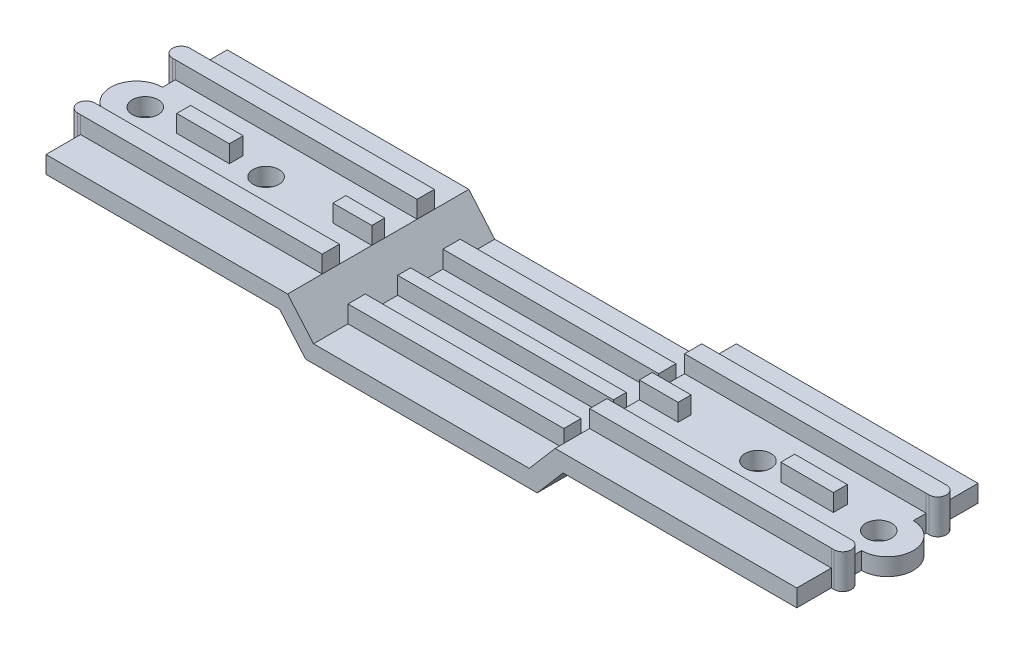
from build123d import *

# Parameters (mm, degrees)
SALIENTE_EXTRUIR1_DEPTH = 10.5
CORTAR_EXTRUIR1_DEPTH   = 48.9869774
ENVOLVER1_OUTLINE_W     = 4.5
ENVOLVER1_OUTLINE_H     = 1.5
ENVOLVER1_OUTLINE_W_2   = 6.094706288
ENVOLVER1_OUTLINE_H_2   = 1.606152826
ENVOLVER1_DEPTH         = 2
ENVOLVER1_START         = -3.5
ENVOLVER1_2_OUTLINE_W   = 25
ENVOLVER1_2_OUTLINE_H   = 2
ENVOLVER1_2_OUTLINE_H_2 = 1.5
ENVOLVER1_2_DEPTH       = 2
CROQUIS5_R              = 1.5
CORTAR_EXTRUIR2_DEPTH   = 48.9869774


# Read off the part's stored shape, not the designer's step: Envolver1
with BuildPart() as part:
    # Croquis1 → Saliente-Extruir1 (new, symmetric)
    with BuildSketch(Plane.XY):
        Polygon((-46.5, 2), (-46.5, 0), (-16.419869845, 0), (-13.785714286, 0), (-15.5, 2), align=None)
        Polygon((-13.785714286, 0), (-16.419869845, 0), (-13.419869845, -3.5), (13.419869845, -3.5), (16.419869845, 0), (13.785714286, 0), (12.5, -1.5), (-12.5, -1.5), align=None)
        Polygon((15.5, 2), (13.785714286, 0), (16.419869845, 0), (46.5, 0), (46.5, 2), align=None)
    extrude(amount=SALIENTE_EXTRUIR1_DEPTH, both=True)

    # Croquis3 → Cortar-Extruir1 (cut, through all)
    with BuildSketch(Plane(origin=(0, 2, 0), x_dir=(1, 0, 0), z_dir=(0, 1, 0))):
        with BuildLine():
            Line((-43.833986837, -4.5), (-43.5, -4.5))
            Line((-43.5, -4.5), (-43.5, -3))
            ThreePointArc((-43.5, -3), (-46.5, 0), (-43.5, 3))
            Line((-43.5, 3), (-43.5, 4.5))
            Line((-43.5, 4.5), (-43.833986837, 4.5))
            ThreePointArc((-43.833986837, 4.5), (-44.833986837, 5.5), (-43.833986837, 6.5))
            Line((-43.833986837, 6.5), (-43.5, 6.5))
            Line((-43.5, 6.5), (-43.5, 10.5))
            Line((-43.5, 10.5), (-43.5, 12.222660865))
            Line((-43.5, 12.222660865), (-52.324213339, 12.222660865))
            Line((-52.324213339, 12.222660865), (-52.324213339, -12.147175549))
            Line((-52.324213339, -12.147175549), (-43.5, -12.147175549))
            Line((-43.5, -12.147175549), (-43.5, -10.5))
            Line((-43.5, -10.5), (-43.5, -6.5))
            Line((-43.5, -6.5), (-43.833986837, -6.5))
            ThreePointArc((-43.833986837, -6.5), (-44.833986837, -5.5), (-43.833986837, -4.5))
        make_face()
        with BuildLine():
            Line((43.5, 12.222660865), (43.5, 10.5))
            Line((43.5, 10.5), (43.5, 6.5))
            Line((43.5, 6.5), (43.833986837, 6.5))
            ThreePointArc((43.833986837, 6.5), (44.833986837, 5.5), (43.833986837, 4.5))
            Line((43.833986837, 4.5), (43.5, 4.5))
            Line((43.5, 4.5), (43.5, 3))
            ThreePointArc((43.5, 3), (46.5, 0), (43.5, -3))
            Line((43.5, -3), (43.5, -4.5))
            Line((43.5, -4.5), (43.833986837, -4.5))
            ThreePointArc((43.833986837, -4.5), (44.833986837, -5.5), (43.833986837, -6.5))
            Line((43.833986837, -6.5), (43.5, -6.5))
            Line((43.5, -6.5), (43.5, -10.5))
            Line((43.5, -10.5), (43.5, -12.147175549))
            Line((43.5, -12.147175549), (52.324213339, -12.147175549))
            Line((52.324213339, -12.147175549), (52.324213339, 12.222660865))
            Line((52.324213339, 12.222660865), (43.5, 12.222660865))
        make_face()
    extrude(amount=-CORTAR_EXTRUIR1_DEPTH, mode=Mode.SUBTRACT)

    # Envolver1 outline → Envolver1 (add)
    with BuildSketch(Plane(origin=(0, 2, 0), x_dir=(1, 0, 0), z_dir=(0, 1, 0))):
        with BuildLine():
            Line((-15.5, -4.5), (-43.833986837, -4.5))
            ThreePointArc((-43.833986837, -4.5), (-44.833986837, -5.5), (-43.833986837, -6.5))
            Line((-43.833986837, -6.5), (-15.5, -6.5))
            Line((-15.5, -6.5), (-15.5, -4.5))
        make_face()
        with BuildLine():
            Line((43.833986837, -4.5), (15.5, -4.5))
            Line((15.5, -4.5), (15.5, -6.5))
            Line((15.5, -6.5), (43.833986837, -6.5))
            ThreePointArc((43.833986837, -6.5), (44.833986837, -5.5), (43.833986837, -4.5))
        make_face()
        with BuildLine():
            Line((-15.5, 6.5), (-43.833986837, 6.5))
            ThreePointArc((-43.833986837, 6.5), (-44.833986837, 5.5), (-43.833986837, 4.5))
            Line((-43.833986837, 4.5), (-15.5, 4.5))
            Line((-15.5, 4.5), (-15.5, 6.5))
        make_face()
        with BuildLine():
            Line((43.833986837, 6.5), (15.5, 6.5))
            Line((15.5, 6.5), (15.5, 4.5))
            Line((15.5, 4.5), (43.833986837, 4.5))
            ThreePointArc((43.833986837, 4.5), (44.833986837, 5.5), (43.833986837, 6.5))
        make_face()
        with Locations((17.75, 0)):
            Rectangle(ENVOLVER1_OUTLINE_W, ENVOLVER1_OUTLINE_H)
        with Locations((-17.75, 0)):
            Rectangle(ENVOLVER1_OUTLINE_W, ENVOLVER1_OUTLINE_H)
        with Locations((35, 0)):
            Rectangle(ENVOLVER1_OUTLINE_W_2, ENVOLVER1_OUTLINE_H_2)
        with Locations((-35, 0)):
            Rectangle(ENVOLVER1_OUTLINE_W_2, ENVOLVER1_OUTLINE_H_2)
    extrude(amount=ENVOLVER1_DEPTH)

    # Envolver1 2 outline → Envolver1 2 (add)
    with BuildSketch(Plane(origin=(0, 2, 0), x_dir=(1, 0, 0), z_dir=(0, 1, 0)).offset(ENVOLVER1_START)):
        with Locations((0, -5.5)):
            Rectangle(ENVOLVER1_2_OUTLINE_W, ENVOLVER1_2_OUTLINE_H)
        with Locations((0, 5.5)):
            Rectangle(ENVOLVER1_2_OUTLINE_W, ENVOLVER1_2_OUTLINE_H)
        Rectangle(ENVOLVER1_2_OUTLINE_W, ENVOLVER1_2_OUTLINE_H_2)
    extrude(amount=ENVOLVER1_2_DEPTH)

    # Croquis5 → Cortar-Extruir2 (cut, through all)
    with BuildSketch(Plane(origin=(0, 2, 0), x_dir=(1, 0, 0), z_dir=(0, 1, 0))):
        with Locations(Location((-42.5, 0, 0), (0, 0, 270))):
            Circle(CROQUIS5_R)
        with Locations(Location((42.5, 0, 0), (0, 0, 270))):
            Circle(CROQUIS5_R)
        with Locations(Location((28.5, 0, 0), (0, 0, 270))):
            Circle(CROQUIS5_R)
        with Locations(Location((-28.5, 0, 0), (0, 0, 270))):
            Circle(CROQUIS5_R)
    extrude(amount=-CORTAR_EXTRUIR2_DEPTH, mode=Mode.SUBTRACT)


solid = part.part
